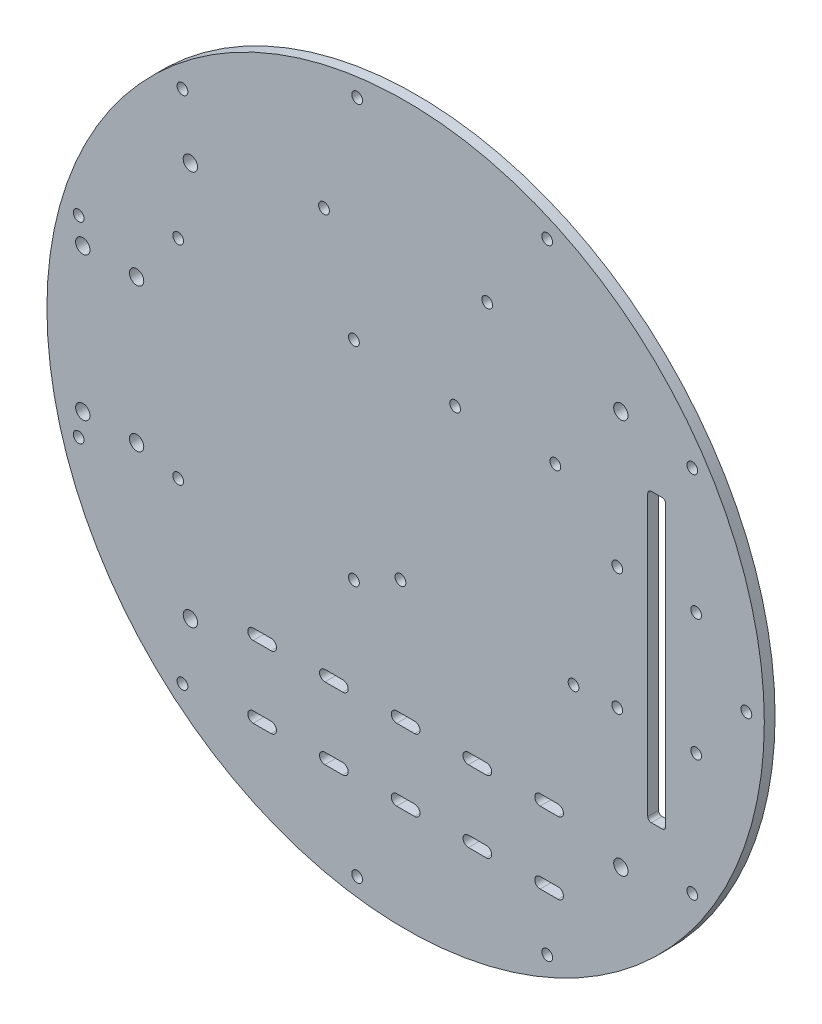
from build123d import *

# Parameters (mm, degrees)
EXTRUDE_1_OUTLINE_R   = 100
EXTRUDE_1_OUTLINE_R_2 = 2
EXTRUDE_1_DEPTH       = 3
CUT_EXTRUDE_1_DEPTH   = 30
SKETCH_6_R            = 1.5
SKETCH_6_R_2          = 2
CUT_EXTRUDE_2_DEPTH   = 10
CUT_EXTRUDE_4_DEPTH   = 10
SKETCH_9_R            = 1.5
CUT_EXTRUDE_5_DEPTH   = 10


# Read off the part's stored shape, not the designer's step: 填料-伸長1
with BuildPart() as part:
    # 填料-伸長1 outline → 填料-伸長1 (new body)
    with BuildSketch(Plane.XY):
        Circle(EXTRUDE_1_OUTLINE_R)
        with Locations((-60, -55)):
            Circle(EXTRUDE_1_OUTLINE_R_2, mode=Mode.SUBTRACT)
        with Locations((60, -55)):
            Circle(EXTRUDE_1_OUTLINE_R_2, mode=Mode.SUBTRACT)
        with Locations((-60, 55)):
            Circle(EXTRUDE_1_OUTLINE_R_2, mode=Mode.SUBTRACT)
        with Locations((60, 55)):
            Circle(EXTRUDE_1_OUTLINE_R_2, mode=Mode.SUBTRACT)
    extrude(amount=EXTRUDE_1_DEPTH)

    # 草圖5 → 除料-伸長1 (cut)
    with BuildSketch(Plane.XY.offset(3)):
        with BuildLine():
            Line((68.5, -40), (71.5, -40))
            ThreePointArc((71.5, -40), (72.207106781, -39.707106781), (72.5, -39))
            Line((72.5, -39), (72.5, 39))
            ThreePointArc((72.5, 39), (72.207106781, 39.707106781), (71.5, 40))
            Line((71.5, 40), (68.5, 40))
            ThreePointArc((68.5, 40), (67.792893219, 39.707106781), (67.5, 39))
            Line((67.5, 39), (67.5, -39))
            ThreePointArc((67.5, -39), (67.792893219, -39.707106781), (68.5, -40))
        make_face()
    extrude(amount=-CUT_EXTRUDE_1_DEPTH, mode=Mode.SUBTRACT)

    # 草圖6 → 除料-伸長2 (cut)
    with BuildSketch(Plane.XY.offset(3)):
        with Locations((-63.405422156, 35.137513831)):
            Circle(SKETCH_6_R)
        with Locations((-14.405422156, 35.137513831)):
            Circle(SKETCH_6_R)
        with Locations((-14.405422156, -22.862486169)):
            Circle(SKETCH_6_R)
        with Locations((-63.405422156, -22.862486169)):
            Circle(SKETCH_6_R)
        with Locations((41.73785257, 33.212145781)):
            Circle(SKETCH_6_R)
        with Locations((13.79785257, 33.212145781)):
            Circle(SKETCH_6_R)
        with Locations((-1.44214743, -16.317854219)):
            Circle(SKETCH_6_R)
        with Locations((46.81785257, -17.587854219)):
            Circle(SKETCH_6_R)
        with Locations((-22.75, 62.76204956)):
            Circle(SKETCH_6_R)
        with Locations((22.75, 62.76204956)):
            Circle(SKETCH_6_R)
        with Locations((59, 17)):
            Circle(SKETCH_6_R)
        with Locations((59, -17)):
            Circle(SKETCH_6_R)
        with Locations((81, -17)):
            Circle(SKETCH_6_R)
        with Locations((81, 17)):
            Circle(SKETCH_6_R)
        with Locations((-90, 20)):
            Circle(SKETCH_6_R_2)
        with Locations((-90, -20)):
            Circle(SKETCH_6_R_2)
        with Locations((-75, 20)):
            Circle(SKETCH_6_R_2)
        with Locations((-75, -20)):
            Circle(SKETCH_6_R_2)
    extrude(amount=-CUT_EXTRUDE_2_DEPTH, mode=Mode.SUBTRACT)

    # 草圖8 → 除料-伸長4 (cut)
    with BuildSketch(Plane.XY.offset(3)):
        with BuildLine():
            Line((-42.5, -48.5), (-37.5, -48.5))
            ThreePointArc((-37.5, -48.5), (-36, -50), (-37.5, -51.5))
            Line((-37.5, -51.5), (-42.5, -51.5))
            ThreePointArc((-42.5, -51.5), (-44, -50), (-42.5, -48.5))
        make_face()
        with BuildLine():
            Line((-22.5, -51.5), (-17.5, -51.5))
            ThreePointArc((-17.5, -51.5), (-16, -50), (-17.5, -48.5))
            Line((-17.5, -48.5), (-22.5, -48.5))
            ThreePointArc((-22.5, -48.5), (-24, -50), (-22.5, -51.5))
        make_face()
        with BuildLine():
            Line((-2.5, -51.5), (2.5, -51.5))
            ThreePointArc((2.5, -51.5), (4, -50), (2.5, -48.5))
            Line((2.5, -48.5), (-2.5, -48.5))
            ThreePointArc((-2.5, -48.5), (-4, -50), (-2.5, -51.5))
        make_face()
        with BuildLine():
            Line((17.5, -51.5), (22.5, -51.5))
            ThreePointArc((22.5, -51.5), (24, -50), (22.5, -48.5))
            Line((22.5, -48.5), (17.5, -48.5))
            ThreePointArc((17.5, -48.5), (16, -50), (17.5, -51.5))
        make_face()
        with BuildLine():
            Line((37.5, -51.5), (42.5, -51.5))
            ThreePointArc((42.5, -51.5), (44, -50), (42.5, -48.5))
            Line((42.5, -48.5), (37.5, -48.5))
            ThreePointArc((37.5, -48.5), (36, -50), (37.5, -51.5))
        make_face()
        with BuildLine():
            Line((-42.5, -68.5), (-37.5, -68.5))
            ThreePointArc((-37.5, -68.5), (-36, -70), (-37.5, -71.5))
            Line((-37.5, -71.5), (-42.5, -71.5))
            ThreePointArc((-42.5, -71.5), (-44, -70), (-42.5, -68.5))
        make_face()
        with BuildLine():
            Line((-22.5, -68.5), (-17.5, -68.5))
            ThreePointArc((-17.5, -68.5), (-16, -70), (-17.5, -71.5))
            Line((-17.5, -71.5), (-22.5, -71.5))
            ThreePointArc((-22.5, -71.5), (-24, -70), (-22.5, -68.5))
        make_face()
        with BuildLine():
            Line((-2.5, -68.5), (2.5, -68.5))
            ThreePointArc((2.5, -68.5), (4, -70), (2.5, -71.5))
            Line((2.5, -71.5), (-2.5, -71.5))
            ThreePointArc((-2.5, -71.5), (-4, -70), (-2.5, -68.5))
        make_face()
        with BuildLine():
            Line((17.5, -68.5), (22.5, -68.5))
            ThreePointArc((22.5, -68.5), (24, -70), (22.5, -71.5))
            Line((22.5, -71.5), (17.5, -71.5))
            ThreePointArc((17.5, -71.5), (16, -70), (17.5, -68.5))
        make_face()
        with BuildLine():
            Line((37.5, -68.5), (42.5, -68.5))
            ThreePointArc((42.5, -68.5), (44, -70), (42.5, -71.5))
            Line((42.5, -71.5), (37.5, -71.5))
            ThreePointArc((37.5, -71.5), (36, -70), (37.5, -68.5))
        make_face()
    extrude(amount=-CUT_EXTRUDE_4_DEPTH, mode=Mode.SUBTRACT)

    # 草圖9 → 除料-伸長5 (cut)
    with BuildSketch(Plane.XY.offset(3)):
        with Locations((95, 0)):
            Circle(SKETCH_9_R)
        with Locations((79.919085619, -51.360877658)):
            Circle(SKETCH_9_R)
        with Locations((39.464426235, -86.415039559)):
            Circle(SKETCH_9_R)
        with Locations((-13.519909636, -94.033036979)):
            Circle(SKETCH_9_R)
        with Locations((-62.211769725, -71.796209564)):
            Circle(SKETCH_9_R)
        with Locations((-91.151832493, -26.7645929)):
            Circle(SKETCH_9_R)
        with Locations((-91.151832493, 26.7645929)):
            Circle(SKETCH_9_R)
        with Locations((-62.211769725, 71.796209564)):
            Circle(SKETCH_9_R)
        with Locations((-13.519909636, 94.033036979)):
            Circle(SKETCH_9_R)
        with Locations((39.464426235, 86.415039559)):
            Circle(SKETCH_9_R)
        with Locations((79.919085619, 51.360877658)):
            Circle(SKETCH_9_R)
    extrude(amount=-CUT_EXTRUDE_5_DEPTH, mode=Mode.SUBTRACT)


solid = part.part
